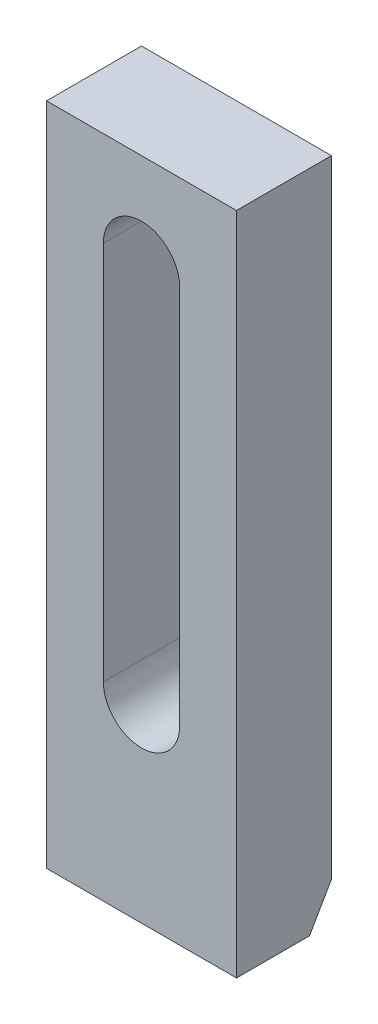
from build123d import *

# Parameters (mm, degrees)
SKETCH_1_W          = 50
SKETCH_1_H          = 175
EXTRUDE_1_DEPTH     = 25
CUT_EXTRUDE_1_DEPTH = 184.711730709
CHAMFER_1_SIZE      = 10
CHAMFER_1_SIZE2     = 5.773502692


with BuildPart() as part:
    # Эскиз1 → Бобышка-Вытянуть1 (new body)
    with BuildSketch(Plane.XY):
        with Locations((25, 87.5)):
            Rectangle(SKETCH_1_W, SKETCH_1_H)
    extrude(amount=EXTRUDE_1_DEPTH)

    # Эскиз2 → Вырез-Вытянуть1 (cut, through all)
    with BuildSketch(Plane.XY.offset(25)):
        with BuildLine():
            Line((14.95, 50), (14.95, 150))
            ThreePointArc((14.95, 150), (25, 160.05), (35.05, 150))
            Line((35.05, 150), (35.05, 50))
            ThreePointArc((35.05, 50), (25, 39.95), (14.95, 50))
        make_face()
    extrude(amount=-CUT_EXTRUDE_1_DEPTH, mode=Mode.SUBTRACT)

    # Фаска1
    chamfer_1_edges = [part.edges().sort_by_distance(p)[0] for p in [
        (25, 0, 0),
    ]]
    chamfer_1_side = [part.faces().sort_by_distance(p)[0] for p in [
        (25, 1.820027472, 0),
    ]]
    chamfer(chamfer_1_edges, length=CHAMFER_1_SIZE, length2=CHAMFER_1_SIZE2, reference=chamfer_1_side[0])


solid = part.part
